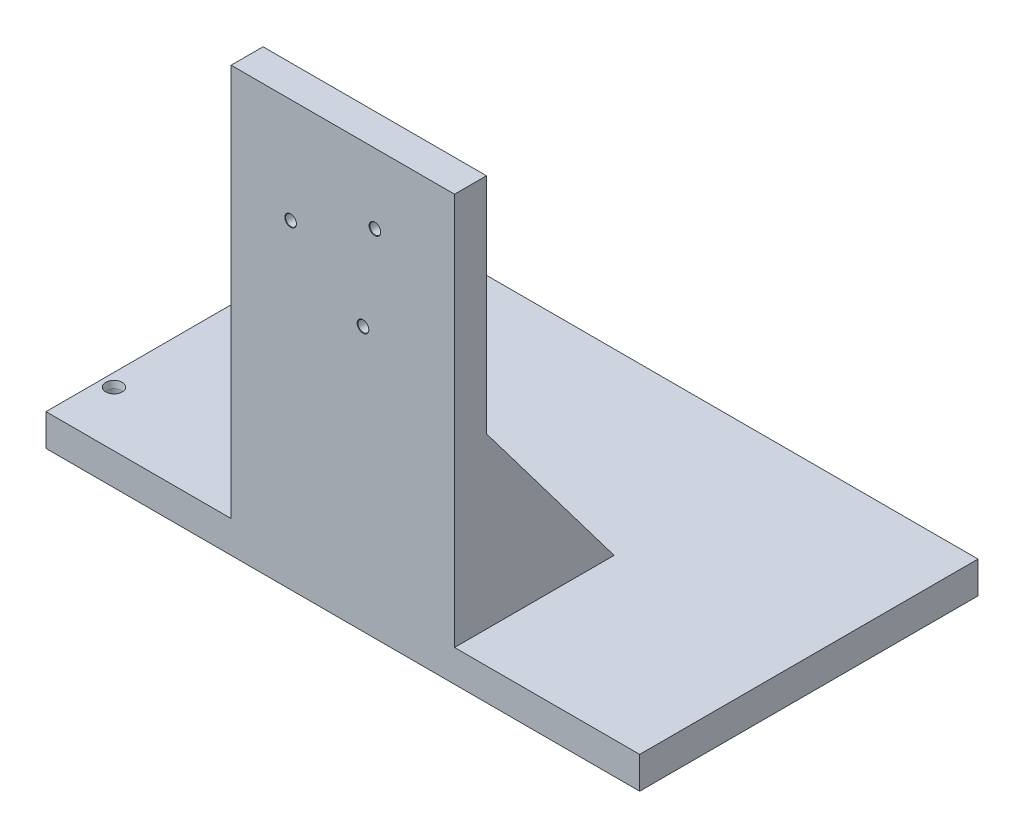
from build123d import *
from OCP.BRepFilletAPI import BRepFilletAPI_MakeChamfer

# Parameters (mm, degrees)
SKETCH1_W                      = 70
SKETCH1_H                      = 70
BOSS_EXTRUDE1_DEPTH            = 10
M3_CLEARANCE_HOLE1_D           = 3.4
M3_CLEARANCE_HOLE1_CSINK_D     = 3.65
M3_CLEARANCE_HOLE1_CSINK_ANGLE = 90
SKETCH14_W                     = 70
SKETCH14_H                     = 10
BOSS_EXTRUDE2_DEPTH            = 63
SKETCH13_W                     = 186
SKETCH13_H                     = 106
BOSS_EXTRUDE3_DEPTH            = 10
CHAMFER1_SIZE                  = 40
CHAMFER1_SIZE2                 = 53
HOLE1_D                        = 4.5
HOLE1_DEPTH                    = 9
HOLE1_CBORE_D                  = 5.2
HOLE1_CBORE_DEPTH              = 2
CHAMFER2_SIZE                  = 2
CHAMFER2_SIZE_2                = 0.35


with BuildPart() as part:
    # Sketch1 → Boss-Extrude1 (new body)
    with BuildSketch(Plane.XY):
        Rectangle(SKETCH1_W, SKETCH1_H)
    extrude(amount=BOSS_EXTRUDE1_DEPTH)

    # M3 Clearance Hole1 (through all)
    with Locations(Plane.XY.offset(10)):
        with Locations((6.314276634, -15.244012286), (10.044563579, 13.090330115), (-16.358840213, 2.153682172)):
            CounterSinkHole(M3_CLEARANCE_HOLE1_D / 2, M3_CLEARANCE_HOLE1_CSINK_D / 2, counter_sink_angle=M3_CLEARANCE_HOLE1_CSINK_ANGLE)

    # Sketch14 → Boss-Extrude2 (add)
    with BuildSketch(Plane.XZ.offset(35)):
        with Locations((0, 5)):
            Rectangle(SKETCH14_W, SKETCH14_H)
    extrude(amount=BOSS_EXTRUDE2_DEPTH)

    # Sketch13 → Boss-Extrude3 (add)
    with BuildSketch(Plane.XZ.offset(98)):
        with Locations((0, -43)):
            Rectangle(SKETCH13_W, SKETCH13_H)
    extrude(amount=-BOSS_EXTRUDE3_DEPTH)

    # Chamfer1
    chamfer1_edges = [part.edges().sort_by_distance(p)[0] for p in [
        (0, -88, 0),
    ]]
    chamfer1_side = [part.faces().sort_by_distance(p)[0] for p in [
        (0, -88, -44.766933109),
    ]]
    chamfer(chamfer1_edges, length=CHAMFER1_SIZE, length2=CHAMFER1_SIZE2, reference=chamfer1_side[0])

    # Hole1
    with Locations(Plane(origin=(0, -88, 0), x_dir=(1, 0, 0), z_dir=(0, 1, 0))):
        with Locations((-89, 7.3), (-89, 82.2), (-40.8, 6), (-73.8, 58.1), (-45.9, 58.1)):
            CounterBoreHole(HOLE1_D / 2, HOLE1_CBORE_D / 2, HOLE1_CBORE_DEPTH, depth=HOLE1_DEPTH)

    # Chamfer2
    chamfer2_edges_1 = [part.edges().sort_by_distance(p)[0] for p in [
        (-43.4, -90, -6),
    ]]
    chamfer2_side_1 = [part.faces().sort_by_distance(p)[0] for p in [
        (-43.4, -89.993, -6),
    ]]
    chamfer2_edges_2 = [part.edges().sort_by_distance(p)[0] for p in [
        (-91.6, -90, -82.2),
    ]]
    chamfer2_side_2 = [part.faces().sort_by_distance(p)[0] for p in [
        (-91.6, -89.993, -82.2),
    ]]
    chamfer2_edges_3 = [part.edges().sort_by_distance(p)[0] for p in [
        (-91.6, -90, -7.3),
    ]]
    chamfer2_side_3 = [part.faces().sort_by_distance(p)[0] for p in [
        (-91.6, -89.993, -7.3),
    ]]
    chamfer2_edges_4 = [part.edges().sort_by_distance(p)[0] for p in [
        (-48.5, -90, -58.1),
    ]]
    chamfer2_side_4 = [part.faces().sort_by_distance(p)[0] for p in [
        (-48.5, -89.993, -58.1),
    ]]
    chamfer2_edges_5 = [part.edges().sort_by_distance(p)[0] for p in [
        (-76.4, -90, -58.1),
    ]]
    chamfer2_side_5 = [part.faces().sort_by_distance(p)[0] for p in [
        (-76.4, -89.993, -58.1),
    ]]
    chamfer2 = BRepFilletAPI_MakeChamfer(part.part.solid().wrapped)
    for e in chamfer2_edges_1:
        chamfer2.Add(CHAMFER2_SIZE - 0.0001, CHAMFER2_SIZE_2 - 0.0001, e.wrapped, chamfer2_side_1[0].wrapped)
    for e in chamfer2_edges_2:
        chamfer2.Add(CHAMFER2_SIZE - 0.0001, CHAMFER2_SIZE_2 - 0.0001, e.wrapped, chamfer2_side_2[0].wrapped)
    for e in chamfer2_edges_3:
        chamfer2.Add(CHAMFER2_SIZE - 0.0001, CHAMFER2_SIZE_2 - 0.0001, e.wrapped, chamfer2_side_3[0].wrapped)
    for e in chamfer2_edges_4:
        chamfer2.Add(CHAMFER2_SIZE - 0.0001, CHAMFER2_SIZE_2 - 0.0001, e.wrapped, chamfer2_side_4[0].wrapped)
    for e in chamfer2_edges_5:
        chamfer2.Add(CHAMFER2_SIZE - 0.0001, CHAMFER2_SIZE_2 - 0.0001, e.wrapped, chamfer2_side_5[0].wrapped)
    add(Compound.cast(chamfer2.Shape()), mode=Mode.REPLACE)  # a hair under: the kernel refuses the full size


solid = part.part
